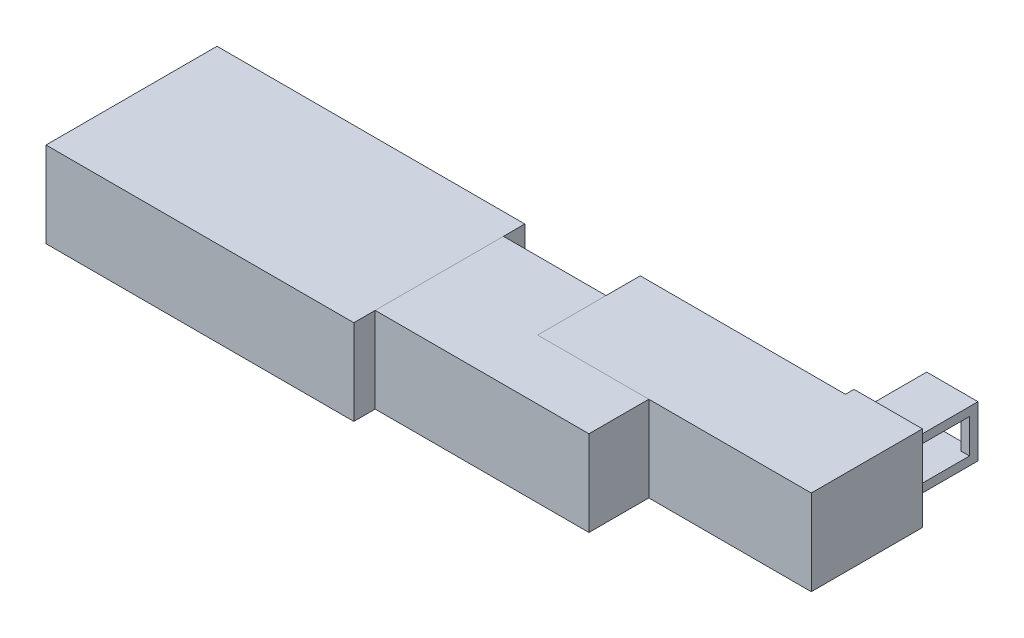
from build123d import *

# Parameters (mm, degrees)
SKETCH1_W           = 36
SKETCH1_H           = 20
BOSS_EXTRUDE1_DEPTH = 10
SKETCH2_W           = 15
SKETCH2_H           = 10
BOSS_EXTRUDE2_DEPTH = 25
SKETCH3_W           = 13
SKETCH3_H           = 13.907546289
CUT_EXTRUDE1_DEPTH  = 25
SKETCH4_W           = 12
SKETCH4_H           = 10
BOSS_EXTRUDE3_DEPTH = 32
SKETCH5_W           = 8
SKETCH5_H           = 10
BOSS_EXTRUDE4_DEPTH = 1
SKETCH6_W           = 6
SKETCH6_H           = 6
BOSS_EXTRUDE5_DEPTH = 8
SHELL2_START        = 73.5
SHELL2_OUTLINE_W    = 4
SHELL2_OUTLINE_H    = 6
SHELL2_DEPTH        = 4
SKETCH7_W           = 7
SKETCH7_H           = 4
CUT_EXTRUDE2_DEPTH  = 1
SKETCH8_W           = 8
SKETCH8_H           = 4
CUT_EXTRUDE3_DEPTH  = 1
SKETCH9_W           = 4
SKETCH9_H           = 4
CUT_EXTRUDE4_DEPTH  = 1
SKETCH10_W          = 0.5
SKETCH10_H          = 0.5
BOSS_EXTRUDE6_DEPTH = 5
CHAMFER1_SIZE       = 0.125


# Read off the part's stored shape, not the designer's step: Shell2
with BuildPart() as part:
    # Sketch1 → Boss-Extrude1 (new body)
    with BuildSketch(Plane(origin=(0, 0, 0), x_dir=(1, 0, 0), z_dir=(0, 1, 0))):
        with Locations((18, 10)):
            Rectangle(SKETCH1_W, SKETCH1_H)
    extrude(amount=BOSS_EXTRUDE1_DEPTH)


with BuildPart() as body_2:
    # Sketch2 → Boss-Extrude2 (new body)
    with BuildSketch(Plane(origin=(36, 0, 0), x_dir=(0, 0, -1), z_dir=(1, 0, 0))):
        with Locations((10, 5)):
            Rectangle(SKETCH2_W, SKETCH2_H)
    extrude(amount=BOSS_EXTRUDE2_DEPTH)

    # Sketch3 → Cut-Extrude1 (cut)
    with BuildSketch(Plane(origin=(0, 10, 0), x_dir=(1, 0, 0), z_dir=(0, 1, 0))):
        with Locations((54.5, 16.453773145)):
            Rectangle(SKETCH3_W, SKETCH3_H)
    extrude(amount=-CUT_EXTRUDE1_DEPTH, mode=Mode.SUBTRACT)


with BuildPart() as body_3:
    # Sketch4 → Boss-Extrude3 (new body)
    with BuildSketch(Plane(origin=(48, 0, 0), x_dir=(0, 0, -1), z_dir=(1, 0, 0))):
        with Locations((15.5, 5)):
            Rectangle(SKETCH4_W, SKETCH4_H)
    extrude(amount=BOSS_EXTRUDE3_DEPTH)

    # Sketch5 → Boss-Extrude4 (add)
    with BuildSketch(Plane(origin=(0, 0, -21.5), x_dir=(-1, 0, 0), z_dir=(0, 0, -1))):
        with Locations((-76, 5)):
            Rectangle(SKETCH5_W, SKETCH5_H)
    extrude(amount=BOSS_EXTRUDE4_DEPTH)


with BuildPart() as body_4:
    # Sketch6 → Boss-Extrude5 (new body)
    with BuildSketch(Plane(origin=(0, 0, -22.5), x_dir=(-1, 0, 0), z_dir=(0, 0, -1))):
        with Locations((-75.5, 5)):
            Rectangle(SKETCH6_W, SKETCH6_H)
    extrude(amount=BOSS_EXTRUDE5_DEPTH)

    # Shell2 outline → Shell2 (cut)
    with BuildSketch(Plane.YZ.offset(SHELL2_START)):
        with Locations((5, -26.5)):
            Rectangle(SHELL2_OUTLINE_W, SHELL2_OUTLINE_H)
    extrude(amount=SHELL2_DEPTH, mode=Mode.SUBTRACT)

    # Sketch7 → Cut-Extrude2 (cut)
    with BuildSketch(Plane(origin=(78.5, 0, 0), x_dir=(0, 0, -1), z_dir=(1, 0, 0))):
        with Locations((26, 5)):
            Rectangle(SKETCH7_W, SKETCH7_H)
    extrude(amount=-CUT_EXTRUDE2_DEPTH, mode=Mode.SUBTRACT)

    # Sketch8 → Cut-Extrude3 (cut)
    with BuildSketch(Plane.ZY.offset(-72.5)):
        with Locations((-26.5, 5)):
            Rectangle(SKETCH8_W, SKETCH8_H)
    extrude(amount=-CUT_EXTRUDE3_DEPTH, mode=Mode.SUBTRACT)

    # Sketch9 → Cut-Extrude4 (cut)
    with BuildSketch(Plane(origin=(0, 0, -30.5), x_dir=(-1, 0, 0), z_dir=(0, 0, -1))):
        with Locations((-75.5, 5)):
            Rectangle(SKETCH9_W, SKETCH9_H)
    extrude(amount=-CUT_EXTRUDE4_DEPTH, mode=Mode.SUBTRACT)

    # Sketch10 → Boss-Extrude6 (add)
    with BuildSketch(Plane(origin=(0, 0, -23.5), x_dir=(-1, 0, 0), z_dir=(0, 0, -1))):
        with Locations((-74.302997824, 6)):
            Rectangle(SKETCH10_W, SKETCH10_H)
        with Locations((-74.302997824, 4)):
            Rectangle(SKETCH10_W, SKETCH10_H)
    extrude(amount=BOSS_EXTRUDE6_DEPTH)

    # Chamfer1
    chamfer1_edges = [body_4.edges().sort_by_distance(p)[0] for p in [
        (74.552997824, 6, -28.5),
        (74.302997824, 5.75, -28.5),
        (74.052997824, 6, -28.5),
        (74.302997824, 6.25, -28.5),
        (74.552997824, 4, -28.5),
        (74.302997824, 3.75, -28.5),
        (74.052997824, 4, -28.5),
        (74.302997824, 4.25, -28.5),
    ]]
    chamfer(chamfer1_edges, length=CHAMFER1_SIZE)


solid = Compound([part.part, body_2.part, body_3.part, body_4.part])
